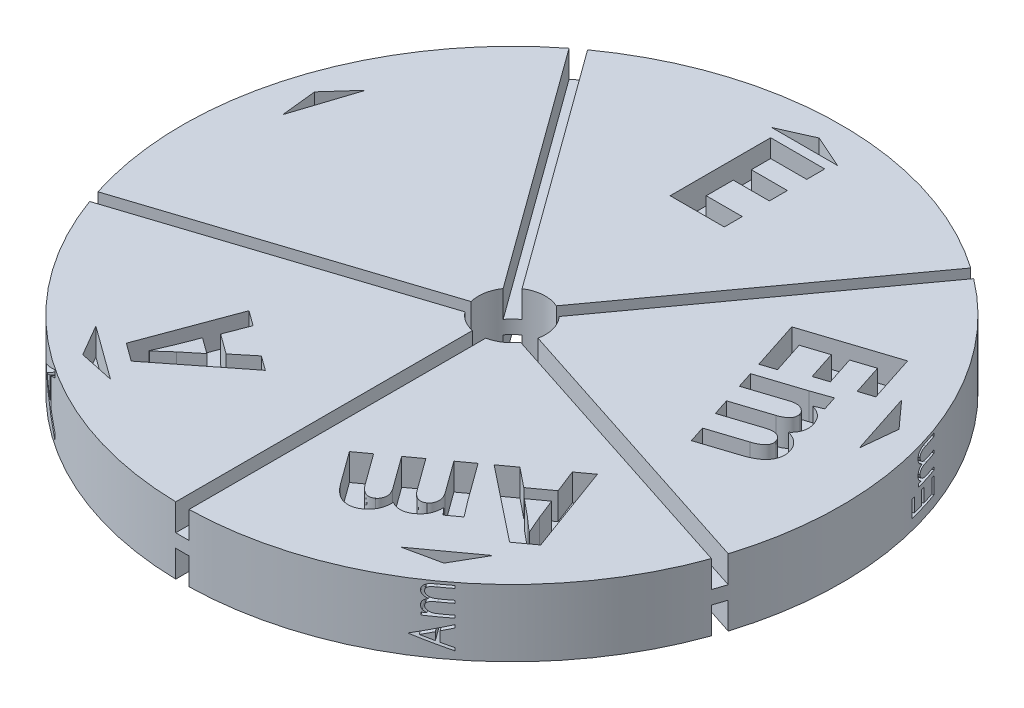
from build123d import *

# Parameters (mm, degrees)
SKETCH2_R           = 31.242
SKETCH2_R_2         = 3.175
BOSS_EXTRUDE1_DEPTH = 6.35
CUT_EXTRUDE2_START  = -2.54
CUT_EXTRUDE2_DEPTH  = 2.54
CUT_EXTRUDE3_DEPTH  = 2.54
CUT_EXTRUDE5_DEPTH  = 2.54
CUT_EXTRUDE6_DEPTH  = 2.54
CUT_EXTRUDE7_DEPTH  = 2.54
CUT_EXTRUDE8_DEPTH  = 2.54


with BuildPart() as part:
    # Sketch2 → Boss-Extrude1 (new body)
    with BuildSketch(Plane(origin=(0, 0, 0), x_dir=(1, 0, 0), z_dir=(0, 1, 0))):
        Circle(SKETCH2_R)
        Circle(SKETCH2_R_2, mode=Mode.SUBTRACT)
    extrude(amount=BOSS_EXTRUDE1_DEPTH)

    # Sketch4 → Cut-Extrude2 (cut)
    with BuildSketch(Plane(origin=(0, 6.35, 0), x_dir=(1, 0, 0), z_dir=(0, 1, 0)).offset(CUT_EXTRUDE2_START)):
        with BuildLine():
            ThreePointArc((1.321164717, 2.887065775), (1.866218176, 2.568628957), (2.337500369, 2.148654702))
            Line((2.337500369, 2.148654702), (18.922396946, 24.975806503))
            Line((18.922396946, 24.975806503), (17.906061294, 25.714217577))
            Line((17.906061294, 25.714217577), (1.321164717, 2.887065775))
        make_face()
        with BuildLine():
            ThreePointArc((-2.621171805, 1.791670552), (-2.210254039, 2.279342468), (-1.710169165, 2.675060079))
            Line((-1.710169165, 2.675060079), (-18.345386326, 25.571472221))
            Line((-18.345386326, 25.571472221), (-19.361721977, 24.833061148))
            Line((-19.361721977, 24.833061148), (-2.621171805, 1.791670552))
        make_face()
        with BuildLine():
            ThreePointArc((-2.513966587, -1.939225877), (-2.850789567, -1.397720948), (-3.072604655, -0.799828503))
            Line((-3.072604655, -0.799828503), (-30.428276462, -9.688225077))
            Line((-30.428276462, -9.688225077), (-30.040070787, -10.882999292))
            Line((-30.040070787, -10.882999292), (-2.513966587, -1.939225877))
        make_face()
        with BuildLine():
            Line((30.260469232, -9.45725824), (3.11069628, -0.63576226))
            ThreePointArc((3.11069628, -0.63576226), (2.922478818, -1.240863634), (2.617840994, -1.796533754))
            Line((2.617840994, -1.796533754), (29.872263557, -10.652032455))
            Line((29.872263557, -10.652032455), (30.260469232, -9.45725824))
        make_face()
        with BuildLine():
            ThreePointArc((0.628129977, -3.112246413), (0, -3.175), (-0.628129977, -3.112246413))
            Line((-0.628129977, -3.112246413), (-0.628129977, -32.075582159))
            Line((-0.628129977, -32.075582159), (0.628129977, -32.075582159))
            Line((0.628129977, -32.075582159), (0.628129977, -3.112246413))
        make_face()
    cut_extrude2 = extrude(amount=CUT_EXTRUDE2_DEPTH, mode=Mode.SUBTRACT)

    # Sketch3 → Cut-Extrude3 (cut)
    # profile 1 of 11: a face of its own
    with BuildSketch(Plane(origin=(0, 6.35, 0), x_dir=(1, 0, 0), z_dir=(0, 1, 0))):
        Polygon((-2.320192308, 26.846368203), (2.808653846, 26.846368203), (2.808653846, 25.136752819), (-0.610576923, 25.136752819), (-0.610576923, 23.305022049), (2.808653846, 23.305022049), (2.808653846, 21.595406665), (-0.610576923, 21.595406665), (-0.610576923, 19.030983588), (2.808653846, 19.030983588), (2.808653846, 17.321368203), (-2.320192308, 17.321368203), align=None)
    # profile 2 of 11: a face of its own
    with BuildSketch(Plane(origin=(0, 6.35, 0), x_dir=(1, 0, 0), z_dir=(0, 1, 0))):
        Polygon((16.061624465, 11.165408665), (18.366605143, 11.914441762), (19.245143963, 9.210936387), (20.54842743, 9.634455101), (19.669888611, 12.337960476), (21.673283032, 12.988989243), (22.604324172, 10.123919802), (23.939920452, 10.557938979), (22.490856423, 15.017107207), (14.208005295, 12.325488274), (15.713071798, 7.693985042), (17.048668079, 8.12800422), align=None)
    # profile 3 of 11: a face of its own
    with BuildSketch(Plane(origin=(0, 6.35, 0), x_dir=(1, 0, 0), z_dir=(0, 1, 0))):
        with BuildLine():
            Line((21.744517704, 6.790660341), (21.735401618, 6.823869398))
            Line((21.735401618, 6.823869398), (22.507949929, 7.158277407))
            Line((22.507949929, 7.158277407), (22.066930442, 8.515415564))
            add(Edge.make_bspline(
                [(22.066930442, 8.515415564), (21.793069657, 8.411137486), (21.200599862, 8.193395745), (20.601267789, 7.99535925), (20.281027341, 7.887048978)],
                knots=[0, 0, 0, 0, 0.464326186, 1, 1, 1, 1], degree=3))
            Line((20.281027341, 7.887048978), (16.092289672, 6.526245822))
            Line((16.092289672, 6.526245822), (16.599812097, 4.964459849))
            Line((16.599812097, 4.964459849), (20.208076243, 6.137011659))
            add(Edge.make_bspline(
                [(20.208076243, 6.137011659), (20.303581676, 6.167428472), (20.446570306, 6.196113322), (20.634500795, 6.22100026), (20.765170007, 6.223863486), (20.889144326, 6.215899216), (21.006531265, 6.196966389), (21.116547379, 6.163322885), (21.252137127, 6.107545693), (21.401517165, 6.019186987), (21.598578277, 5.851829373), (21.699344804, 5.68969266), (21.736323469, 5.572997026)],
                knots=[0, 0, 0, 0, 0.166013403, 0.241834974, 0.314413964, 0.382586504, 0.44789349, 0.511308969, 0.573121726, 0.691025745, 0.797761554, 1, 1, 1, 1], degree=3))
            add(Edge.make_bspline(
                [(21.736323469, 5.572997026), (21.758803363, 5.500116599), (21.779085078, 5.389968116), (21.779681943, 5.244792996), (21.76648356, 5.14394998), (21.740640234, 5.047427839), (21.698127107, 4.956557008), (21.644661838, 4.869305517), (21.551632948, 4.760816616), (21.411511521, 4.636634343), (21.136369171, 4.455888364), (20.898475305, 4.358993731), (20.730071416, 4.306168301)],
                knots=[0, 0, 0, 0, 0.125368565, 0.182880941, 0.238166827, 0.292234244, 0.346525235, 0.402630324, 0.460044328, 0.580942748, 0.709299201, 1, 1, 1, 1], degree=3))
            Line((20.730071416, 4.306168301), (17.18783808, 3.154942307))
            Line((17.18783808, 3.154942307), (17.695360506, 1.593156333))
            Line((17.695360506, 1.593156333), (21.335937465, 2.776208608))
            add(Edge.make_bspline(
                [(21.335937465, 2.776208608), (21.433843159, 2.805573117), (21.578847176, 2.839038007), (21.769204236, 2.862240211), (21.899160599, 2.867630887), (22.02150783, 2.861064201), (22.136242495, 2.84422498), (22.242790612, 2.812165454), (22.370606572, 2.756455053), (22.511085979, 2.668091982), (22.697166494, 2.500357399), (22.790617334, 2.338631039), (22.824517872, 2.223193774)],
                knots=[0, 0, 0, 0, 0.172621452, 0.25066996, 0.323610578, 0.391985162, 0.457362096, 0.518957846, 0.579289924, 0.692443371, 0.79757912, 1, 1, 1, 1], degree=3))
            add(Edge.make_bspline(
                [(22.824517872, 2.223193774), (22.848869589, 2.149588583), (22.869110652, 2.037460612), (22.869162266, 1.889622069), (22.857428587, 1.785940569), (22.826534076, 1.687248616), (22.781388895, 1.59361474), (22.724652828, 1.502579225), (22.623263084, 1.388518728), (22.467877789, 1.254205041), (22.148422815, 1.056743703), (21.872799601, 0.94763215), (21.675686131, 0.885894629)],
                knots=[0, 0, 0, 0, 0.116847431, 0.170441447, 0.222803547, 0.273664007, 0.325667837, 0.379420182, 0.434957811, 0.555338216, 0.688012192, 1, 1, 1, 1], degree=3))
            Line((21.675686131, 0.885894629), (18.283386489, -0.216361209))
            Line((18.283386489, -0.216361209), (18.790908914, -1.778147182))
            Line((18.790908914, -1.778147182), (22.431485873, -0.595094907))
            add(Edge.make_bspline(
                [(22.431485873, -0.595094907), (22.632318385, -0.52806093), (22.918752923, -0.415556978), (23.271341853, -0.234498806), (23.500124322, -0.095316507), (23.702841551, 0.051644685), (23.87845508, 0.208274744), (24.027453002, 0.373648163), (24.146920326, 0.549251738), (24.244809427, 0.728069174), (24.317914621, 0.91128684), (24.374052033, 1.096201041), (24.404799236, 1.284630867), (24.412774627, 1.47601423), (24.394806413, 1.738103984), (24.348456848, 1.93318061), (24.306035552, 2.060947922)],
                knots=[0, 0, 0, 0, 0.172995803, 0.250842261, 0.323557111, 0.391577454, 0.455103819, 0.515479352, 0.572919993, 0.62823557, 0.681690649, 0.733800434, 0.785820317, 0.837192912, 0.8899768, 1, 1, 1, 1], degree=3))
            add(Edge.make_bspline(
                [(24.306035552, 2.060947922), (24.255653479, 2.227126112), (24.147665941, 2.465334901), (23.948755205, 2.750498397), (23.771774172, 2.947230717), (23.563527606, 3.127284492), (23.22178535, 3.339082314), (22.930880091, 3.451966672), (22.726187052, 3.512966357)],
                knots=[0, 0, 0, 0, 0.232075901, 0.347037781, 0.46400119, 0.585291806, 0.71405303, 1, 1, 1, 1], degree=3))
            Line((22.726187052, 3.512966357), (22.720551915, 3.535774178))
            add(Edge.make_bspline(
                [(22.720551915, 3.535774178), (22.85051314, 3.641703388), (23.022248944, 3.826608986), (23.183262782, 4.118027769), (23.268366711, 4.351251706), (23.318353266, 4.598246212), (23.330203745, 4.950266251), (23.281416624, 5.2159256), (23.224396538, 5.389446163)],
                knots=[0, 0, 0, 0, 0.245810699, 0.364787803, 0.48585838, 0.608329151, 0.732517645, 1, 1, 1, 1], degree=3))
            add(Edge.make_bspline(
                [(23.224396538, 5.389446163), (23.188158971, 5.495167723), (23.125689087, 5.647492881), (23.02556091, 5.837178401), (22.946321402, 5.965533854), (22.863404366, 6.084368369), (22.772362859, 6.191341255), (22.676247647, 6.288245081), (22.54104176, 6.400057803), (22.369489779, 6.519884352), (22.099694944, 6.675967802), (21.887149331, 6.756582145), (21.744517704, 6.790660341)],
                knots=[0, 0, 0, 0, 0.157381183, 0.231375592, 0.301837962, 0.369720387, 0.435228795, 0.499422885, 0.561679052, 0.682063178, 0.793712791, 1, 1, 1, 1], degree=3))
        make_face()
    # profile 4 of 11: a face of its own
    with BuildSketch(Plane(origin=(0, 6.35, 0), x_dir=(1, 0, 0), z_dir=(0, 1, 0))):
        Polygon((20.215288557, -17.487812686), (17.094083655, -8.990795944), (15.719708798, -9.989228264), (16.585308088, -12.201994992), (14.697833283, -13.573175378), (12.842684096, -12.079279921), (11.422496743, -13.110993319), (18.511063733, -18.725868763), align=None)
        with BuildLine():
            Line((18.613664517, -16.94384352), (18.587767854, -16.962390979))
            add(Edge.make_bspline(
                [(18.587767854, -16.962390979), (18.362196165, -16.762235832), (17.912652854, -16.353596591), (17.454957791, -15.954047493), (17.220644574, -15.757318298)],
                knots=[0, 0, 0, 0, 0.496404428, 1, 1, 1, 1], degree=3))
            Line((17.220644574, -15.757318298), (15.635741896, -14.459594747))
            Line((15.635741896, -14.459594747), (17.13839174, -13.36797541))
            Line((17.13839174, -13.36797541), (17.888410706, -15.286761155))
            add(Edge.make_bspline(
                [(17.888410706, -15.286761155), (18.001055747, -15.562446104), (18.239913244, -16.116161951), (18.491142566, -16.664330533), (18.613664517, -16.94384352)],
                knots=[0, 0, 0, 0, 0.493880145, 1, 1, 1, 1], degree=3))
        make_face(mode=Mode.SUBTRACT)
    # profile 5 of 11: a face of its own
    with BuildSketch(Plane(origin=(0, 6.35, 0), x_dir=(1, 0, 0), z_dir=(0, 1, 0))):
        with BuildLine():
            Line((12.543456694, -19.045688456), (12.571077027, -19.024111371))
            Line((12.571077027, -19.024111371), (13.127774465, -19.655542792))
            Line((13.127774465, -19.655542792), (14.282249346, -18.816859644))
            add(Edge.make_bspline(
                [(14.282249346, -18.816859644), (14.095101032, -18.591505554), (13.715355377, -18.087800359), (13.330670959, -17.587930342), (13.133441611, -17.313427186)],
                knots=[0, 0, 0, 0, 0.464235478, 1, 1, 1, 1], degree=3))
            Line((13.133441611, -17.313427186), (10.54474355, -13.749135033))
            Line((10.54474355, -13.749135033), (9.216181187, -14.714286276))
            Line((9.216181187, -14.714286276), (11.446013369, -17.783723458))
            add(Edge.make_bspline(
                [(11.446013369, -17.783723458), (11.502990117, -17.866174291), (11.575865397, -17.992843313), (11.656123921, -18.164498472), (11.701114941, -18.287117817), (11.730083659, -18.40825437), (11.749638909, -18.526015233), (11.752006728, -18.641595114), (11.741651813, -18.787420652), (11.703313792, -18.956552611), (11.605383222, -19.195813556), (11.480776159, -19.341273338), (11.381514177, -19.412790182)],
                knots=[0, 0, 0, 0, 0.166107114, 0.241931524, 0.314167343, 0.382302066, 0.448306284, 0.511766893, 0.573555552, 0.690523399, 0.79773616, 1, 1, 1, 1], degree=3))
            add(Edge.make_bspline(
                [(11.381514177, -19.412790182), (11.318390661, -19.454575993), (11.221304832, -19.510257592), (11.083873167, -19.555465677), (10.983533468, -19.574437632), (10.883637799, -19.577011298), (10.784217733, -19.567798636), (10.685569587, -19.542151032), (10.553733747, -19.488163692), (10.391143794, -19.393660285), (10.13461856, -19.186814618), (9.967851815, -18.991439121), (9.865580709, -18.84738797)],
                knots=[0, 0, 0, 0, 0.124851952, 0.182559899, 0.237395695, 0.292260957, 0.346466819, 0.401191977, 0.459283741, 0.580485066, 0.709084836, 1, 1, 1, 1], degree=3))
            Line((9.865580709, -18.84738797), (7.676881347, -15.832530475))
            Line((7.676881347, -15.832530475), (6.348318984, -16.797681717))
            Line((6.348318984, -16.797681717), (8.598119812, -19.894606397))
            add(Edge.make_bspline(
                [(8.598119812, -19.894606397), (8.654618998, -19.979942281), (8.735092559, -20.105972812), (8.813165927, -20.281525813), (8.861156878, -20.403185354), (8.891944353, -20.522100706), (8.908830356, -20.636978176), (8.912465348, -20.747565612), (8.899300705, -20.88660287), (8.857493992, -21.047206343), (8.757291316, -21.276924183), (8.630429488, -21.414723954), (8.531559258, -21.482653933)],
                knots=[0, 0, 0, 0, 0.173022909, 0.25097622, 0.323896322, 0.393417358, 0.457674722, 0.519451934, 0.579613048, 0.692719402, 0.797903228, 1, 1, 1, 1], degree=3))
            add(Edge.make_bspline(
                [(8.531559258, -21.482653933), (8.468701815, -21.527892933), (8.369006146, -21.583043132), (8.228485079, -21.628971888), (8.125371428, -21.647257227), (8.021997391, -21.65120466), (7.918361258, -21.636883097), (7.815122738, -21.609355533), (7.67518215, -21.54904976), (7.499876421, -21.441926169), (7.212997408, -21.199591675), (7.025516781, -20.969456642), (6.904184195, -20.802532431)],
                knots=[0, 0, 0, 0, 0.116790975, 0.170487713, 0.22238944, 0.274343501, 0.325870813, 0.379656045, 0.435071312, 0.555225712, 0.688094073, 1, 1, 1, 1], degree=3))
            Line((6.904184195, -20.802532431), (4.809019144, -17.915925916))
            Line((4.809019144, -17.915925916), (3.480456781, -18.881077159))
            Line((3.480456781, -18.881077159), (5.73025761, -21.978001838))
            add(Edge.make_bspline(
                [(5.73025761, -21.978001838), (5.856645407, -22.148027097), (6.05053957, -22.387502482), (6.331867421, -22.667379854), (6.535255091, -22.842133789), (6.738090668, -22.989083753), (6.941937895, -23.106879151), (7.144603624, -23.198425131), (7.348350494, -23.25916548), (7.549124076, -23.294812433), (7.746370909, -23.310882935), (7.939192561, -23.301490394), (8.128185221, -23.274814847), (8.312202099, -23.222167006), (8.557931178, -23.127872296), (8.728182747, -23.021034803), (8.836384799, -22.941227756)],
                knots=[0, 0, 0, 0, 0.173047411, 0.250945515, 0.323703412, 0.391778996, 0.455121368, 0.515622304, 0.572909428, 0.628199869, 0.681870989, 0.7341014, 0.785508388, 0.837339278, 0.890015294, 1, 1, 1, 1], degree=3))
            add(Edge.make_bspline(
                [(8.836384799, -22.941227756), (8.976121923, -22.839956914), (9.172249294, -22.66715392), (9.380787987, -22.3890015), (9.512819353, -22.159274679), (9.620082396, -21.905998974), (9.718180291, -21.516304021), (9.735570938, -21.204654437), (9.729556409, -20.990999835)],
                knots=[0, 0, 0, 0, 0.23128825, 0.346683186, 0.463962733, 0.585241334, 0.713653856, 1, 1, 1, 1], degree=3))
            Line((9.729556409, -20.990999835), (9.748246307, -20.976807164))
            add(Edge.make_bspline(
                [(9.748246307, -20.976807164), (9.888613774, -21.068648947), (10.117440984, -21.176545904), (10.444789384, -21.237921686), (10.692809756, -21.248299528), (10.9437323, -21.218930454), (11.282163409, -21.119531232), (11.520434689, -20.991765469), (11.6683124, -20.884474781)],
                knots=[0, 0, 0, 0, 0.245830052, 0.364726023, 0.485588232, 0.608004352, 0.732803485, 1, 1, 1, 1], degree=3))
            add(Edge.make_bspline(
                [(11.6683124, -20.884474781), (11.83774195, -20.75451788), (12.065590501, -20.542106111), (12.294260473, -20.213596863), (12.404677549, -19.965977679), (12.477981019, -19.721994324), (12.544417635, -19.417989348), (12.553469423, -19.190996575), (12.543456694, -19.045688456)],
                knots=[0, 0, 0, 0, 0.301371534, 0.435589983, 0.561794324, 0.681954187, 0.79454247, 1, 1, 1, 1], degree=3))
        make_face()
    # profile 6 of 11: a face of its own
    with BuildSketch(Plane(origin=(0, 6.35, 0), x_dir=(1, 0, 0), z_dir=(0, 1, 0))):
        Polygon((-14.28777771, -21.794747306), (-7.171723222, -16.199840508), (-8.54609808, -15.201408188), (-10.38292227, -16.708616075), (-12.270397074, -15.337435689), (-11.423122782, -13.111356531), (-12.843310135, -12.079643133), (-15.992002533, -20.556691229), align=None)
        with BuildLine():
            Line((-14.264283302, -20.105489765), (-14.291181838, -20.084519245))
            add(Edge.make_bspline(
                [(-14.291181838, -20.084519245), (-14.169969912, -19.808715112), (-13.919950936, -19.255810723), (-13.683493469, -18.696942243), (-13.56777333, -18.414199669)],
                knots=[0, 0, 0, 0, 0.496504464, 1, 1, 1, 1], degree=3))
            Line((-13.56777333, -18.414199669), (-12.823480726, -16.503416107))
            Line((-12.823480726, -16.503416107), (-11.320830882, -17.595035444))
            Line((-11.320830882, -17.595035444), (-12.913799761, -18.901449365))
            add(Edge.make_bspline(
                [(-12.913799761, -18.901449365), (-13.140410242, -19.094949127), (-13.59266849, -19.49401682), (-14.0388312, -19.899854931), (-14.264283302, -20.105489765)],
                knots=[0, 0, 0, 0, 0.494052073, 1, 1, 1, 1], degree=3))
        make_face(mode=Mode.SUBTRACT)
    # profile 7 of 11: a face of its own
    with BuildSketch(Plane(origin=(0, 6.35, 0), x_dir=(1, 0, 0), z_dir=(0, 1, 0))):
        Polygon((0, 29.121822197), (-3.104495287, 27.736076068), (3.13558484, 27.736076068), align=None)
    # profile 8 of 11: a face of its own
    with BuildSketch(Plane(origin=(0, 6.35, 0), x_dir=(1, 0, 0), z_dir=(0, 1, 0))):
        Polygon((27.347524884, 5.588800468), (27.696498767, 8.999137966), (25.419234079, 11.523469335), align=None)
    # profile 9 of 11: a face of its own
    with BuildSketch(Plane(origin=(0, 6.35, 0), x_dir=(1, 0, 0), z_dir=(0, 1, 0))):
        Polygon((13.766115046, -24.282007423), (17.117377607, -23.560049064), (18.814445916, -20.614180351), align=None)
    # profile 10 of 11: a face of its own
    with BuildSketch(Plane(origin=(0, 6.35, 0), x_dir=(1, 0, 0), z_dir=(0, 1, 0))):
        Polygon((-18.839597892, -20.59590637), (-17.117377607, -23.560049064), (-13.791267023, -24.263733442), align=None)
    # profile 11 of 11: a face of its own
    with BuildSketch(Plane(origin=(0, 6.35, 0), x_dir=(1, 0, 0), z_dir=(0, 1, 0))):
        Polygon((-25.409626878, 11.553037257), (-27.696498767, 8.999137966), (-27.337917684, 5.61836839), align=None)
    extrude(amount=-CUT_EXTRUDE3_DEPTH, mode=Mode.SUBTRACT)

    # Sketch6 → Cut-Extrude5 (cut)
    with BuildSketch(Plane(origin=(29.712907682, 6.35, -9.654308938), x_dir=(-0.3090169943749509, 0, -0.9510565162951525), z_dir=(0.9510565162951525, 0, -0.30901699437495095))):
        with BuildLine():
            Line((-1.265935326, -3.325207933), (-1.265935326, -3.040272036))
            Line((-1.265935326, -3.040272036), (-0.86270015, -3.040272036))
            add(Edge.make_bspline(
                [(-0.86270015, -3.040272036), (-0.897875684, -3.017956676), (-0.964834333, -2.975478107), (-1.05411956, -2.905811416), (-1.129687066, -2.836246052), (-1.169839746, -2.785328475), (-1.188977193, -2.761060297)],
                knots=[0, 0, 0, 0, 1.156398484, 2.201270891, 3.14269527, 4, 4, 4, 4], degree=3))
            add(Edge.make_bspline(
                [(-1.188977193, -2.761060297), (-1.207078671, -2.728212295), (-1.242714502, -2.663545427), (-1.279648269, -2.559817422), (-1.301920857, -2.453547339), (-1.305067319, -2.381674843), (-1.306640454, -2.345740786)],
                knots=[0, 0, 0, 0, 1.029112214, 2.025982067, 3.013051199, 4, 4, 4, 4], degree=3))
            add(Edge.make_bspline(
                [(-1.306640454, -2.345740786), (-1.305689013, -2.32152618), (-1.303799462, -2.273436253), (-1.291495166, -2.202017857), (-1.270420031, -2.132658791), (-1.241086817, -2.065989222), (-1.204929825, -2.003530897), (-1.163710277, -1.945711234), (-1.116295634, -1.89464049), (-1.062621221, -1.848838411), (-1.000115551, -1.80715885), (-0.925911028, -1.770653993), (-0.84065773, -1.735081551), (-0.778928428, -1.715577516), (-0.746308924, -1.705271034)],
                knots=[0, 0, 0, 0, 0.946455476, 1.879649655, 2.823380467, 3.773312109, 4.71994895, 5.639914597, 6.5429676, 7.43638817, 8.392480427, 9.470921426, 10.663563517, 12, 12, 12, 12], degree=3))
            add(Edge.make_bspline(
                [(-0.746308924, -1.705271034), (-0.789897153, -1.683121294), (-0.874045586, -1.640360532), (-0.987559307, -1.562515229), (-1.085498466, -1.47748146), (-1.165291422, -1.383400224), (-1.228573287, -1.283766727), (-1.273352991, -1.179187946), (-1.301626442, -1.070734649), (-1.304964663, -0.996915624), (-1.306640454, -0.959858374)],
                knots=[0, 0, 0, 0, 1.189404311, 2.296182004, 3.342184252, 4.338261437, 5.289258256, 6.204982299, 7.098898681, 8, 8, 8, 8], degree=3))
            add(Edge.make_bspline(
                [(-1.306640454, -0.959858374), (-1.3051764, -0.925814118), (-1.302297985, -0.858881173), (-1.279432609, -0.761640044), (-1.241527774, -0.670642915), (-1.18817883, -0.587145111), (-1.121774402, -0.51171346), (-1.042447291, -0.446280843), (-0.951327997, -0.391394051), (-0.866268845, -0.355161258), (-0.791019056, -0.330801322), (-0.726574161, -0.315154053), (-0.655432717, -0.301912167), (-0.5776989, -0.291486983), (-0.493557561, -0.282143116), (-0.402479628, -0.277100099), (-0.304739131, -0.272922599), (-0.237288294, -0.272527178), (-0.202513851, -0.272323318)],
                knots=[0, 0, 0, 0, 1.111047388, 2.184382424, 3.24278181, 4.316652798, 5.405819654, 6.512304555, 7.661871258, 8.868441487, 9.523209744, 10.243700779, 11.032770805, 11.885734012, 12.804907568, 13.797084314, 14.864281476, 16, 16, 16, 16], degree=3))
            Line((-0.202513851, -0.272323318), (1.054256982, -0.272323318))
            Line((1.054256982, -0.272323318), (1.054256982, -0.557259215))
            Line((1.054256982, -0.557259215), (-0.203785887, -0.557259215))
            add(Edge.make_bspline(
                [(-0.203785887, -0.557259215), (-0.233466962, -0.557391262), (-0.290503724, -0.557645012), (-0.372373333, -0.559280785), (-0.447007636, -0.56323477), (-0.514459736, -0.568178115), (-0.574708758, -0.574454775), (-0.627851572, -0.581785543), (-0.673527139, -0.591181966), (-0.724207605, -0.605403659), (-0.779786765, -0.627950963), (-0.840198592, -0.662261152), (-0.892513704, -0.706470094), (-0.938728867, -0.757055546), (-0.975627103, -0.815192512), (-1.002834105, -0.879096513), (-1.019098679, -0.948663293), (-1.020822222, -0.996872367), (-1.021704557, -1.021552084)],
                knots=[0, 0, 0, 0, 1.330018142, 2.555834944, 3.668782313, 4.67863418, 5.586109635, 6.382798523, 7.081476318, 7.673906836, 8.739419882, 9.761044311, 10.773038723, 11.795502015, 12.820653859, 13.842278288, 14.895395529, 16, 16, 16, 16], degree=3))
            add(Edge.make_bspline(
                [(-1.021704557, -1.021552084), (-1.020010596, -1.051797883), (-1.016630816, -1.112144098), (-0.992410072, -1.200593914), (-0.951184774, -1.284234386), (-0.895708398, -1.362859467), (-0.827379293, -1.434596754), (-0.746498964, -1.496057968), (-0.655696214, -1.54774392), (-0.571394601, -1.581945293), (-0.495786421, -1.603547719), (-0.429535618, -1.61806998), (-0.35413988, -1.630009977), (-0.27004968, -1.639098965), (-0.177162414, -1.646756421), (-0.075584595, -1.652495293), (0.035127153, -1.655448363), (0.111889344, -1.656007398), (0.151747967, -1.656297677)],
                knots=[0, 0, 0, 0, 0.970977457, 1.937287705, 2.920979925, 3.952440061, 5.016820328, 6.090050699, 7.203235515, 8.364032368, 9.001938422, 9.727226715, 10.541084532, 11.452475461, 12.443212931, 13.53443812, 14.719761628, 16, 16, 16, 16], degree=3))
            Line((0.151747967, -1.656297677), (1.054256982, -1.656297677))
            Line((1.054256982, -1.656297677), (1.054256982, -1.941233574))
            Line((1.054256982, -1.941233574), (-0.125555718, -1.941233574))
            add(Edge.make_bspline(
                [(-0.125555718, -1.941233574), (-0.158840907, -1.941366055), (-0.222873149, -1.941620915), (-0.314702695, -1.943252689), (-0.398243424, -1.947186165), (-0.473318149, -1.952162579), (-0.53994931, -1.958302638), (-0.598270209, -1.966030222), (-0.648357217, -1.974265291), (-0.703156065, -1.988743089), (-0.762955779, -2.01112924), (-0.827799573, -2.04538647), (-0.884277453, -2.089526291), (-0.93348112, -2.140794727), (-0.972962057, -2.199265245), (-1.001773712, -2.263712878), (-1.018369407, -2.333672197), (-1.020579004, -2.382119691), (-1.021704557, -2.406798478)],
                knots=[0, 0, 0, 0, 1.395550625, 2.684684642, 3.850322058, 4.90159369, 5.839127943, 6.655000055, 7.368146774, 7.965344177, 9.028572653, 10.038758203, 11.027281416, 12.020668143, 13.006790664, 13.969767158, 14.965814729, 16, 16, 16, 16], degree=3))
            add(Edge.make_bspline(
                [(-1.021704557, -2.406798478), (-1.020316583, -2.436011051), (-1.017545046, -2.494343376), (-0.99237288, -2.579751749), (-0.952938558, -2.662058141), (-0.89899647, -2.740497138), (-0.831502556, -2.812114275), (-0.752667361, -2.874850613), (-0.663128762, -2.927291815), (-0.580345091, -2.962441378), (-0.506581729, -2.984775826), (-0.443551803, -3.000031628), (-0.373453293, -3.012602917), (-0.296571474, -3.022406124), (-0.212823111, -3.030880951), (-0.122227286, -3.036373886), (-0.024450562, -3.039443), (0.04298666, -3.039988866), (0.077969923, -3.040272036)],
                knots=[0, 0, 0, 0, 0.986498303, 1.969862037, 2.986972612, 4.06537281, 5.176764093, 6.304882096, 7.462534857, 8.67759155, 9.337881572, 10.06860333, 10.870597364, 11.746116293, 12.690428084, 13.718232799, 14.816326358, 16, 16, 16, 16], degree=3))
            Line((0.077969923, -3.040272036), (1.054256982, -3.040272036))
            Line((1.054256982, -3.040272036), (1.054256982, -3.325207933))
            Line((1.054256982, -3.325207933), (-1.265935326, -3.325207933))
        make_face()
        Polygon((-2.120743018, -5.360464343), (-2.120743018, -3.772964343), (-1.795101993, -3.772964343), (-1.795101993, -5.075528446), (-0.818178916, -5.075528446), (-0.818178916, -3.772964343), (-0.49253789, -3.772964343), (-0.49253789, -5.075528446), (0.728615956, -5.075528446), (0.728615956, -3.772964343), (1.054256982, -3.772964343), (1.054256982, -5.360464343), align=None)
    extrude(amount=-CUT_EXTRUDE5_DEPTH, mode=Mode.SUBTRACT)

    # Sketch7 → Cut-Extrude6 (cut)
    # profile 1 of 2: a face of its own
    with BuildSketch(Plane(origin=(18.363586852, 6.35, 25.275308938), x_dir=(0.8090169943749508, 0, -0.5877852522924687), z_dir=(0.5877852522924687, 0, 0.8090169943749508))):
        with BuildLine():
            Line((-1.223357827, -2.932275185), (-1.223357827, -2.688044416))
            Line((-1.223357827, -2.688044416), (-0.82012265, -2.688044416))
            add(Edge.make_bspline(
                [(-0.82012265, -2.688044416), (-0.855276832, -2.668521251), (-0.922022436, -2.631453531), (-1.010898571, -2.569327014), (-1.086636249, -2.508278247), (-1.127203129, -2.462793374), (-1.146399694, -2.441269576)],
                knots=[0, 0, 0, 0, 1.171933473, 2.225095347, 3.16010125, 4, 4, 4, 4], degree=3))
            add(Edge.make_bspline(
                [(-1.146399694, -2.441269576), (-1.16445488, -2.412270828), (-1.199724612, -2.3556235), (-1.236892893, -2.264007063), (-1.259341698, -2.170138594), (-1.26249069, -2.106631819), (-1.264062955, -2.074923423)],
                knots=[0, 0, 0, 0, 1.048657587, 2.048490186, 3.025627617, 4, 4, 4, 4], degree=3))
            add(Edge.make_bspline(
                [(-1.264062955, -2.074923423), (-1.263089194, -2.053464182), (-1.261145862, -2.010638018), (-1.249103438, -1.94733023), (-1.227483265, -1.886154556), (-1.198262221, -1.827322129), (-1.162343916, -1.771885587), (-1.120600602, -1.721023263), (-1.073429179, -1.675733059), (-1.019591141, -1.63529901), (-0.957246195, -1.598079742), (-0.882981318, -1.56626981), (-0.797998375, -1.534227542), (-0.736346189, -1.517641797), (-0.703731424, -1.508867733)],
                knots=[0, 0, 0, 0, 0.894244548, 1.784642113, 2.672934302, 3.589368707, 4.515457188, 5.419074897, 6.32489156, 7.232901851, 8.219046244, 9.34187893, 10.593821297, 12, 12, 12, 12], degree=3))
            add(Edge.make_bspline(
                [(-0.703731424, -1.508867733), (-0.747237412, -1.489439254), (-0.830814966, -1.452116006), (-0.944168428, -1.383349432), (-1.041970835, -1.308699244), (-1.122327383, -1.226152369), (-1.185272336, -1.138170393), (-1.230780706, -1.045942552), (-1.258888188, -0.949959875), (-1.262342389, -0.884478381), (-1.264062955, -0.851861523)],
                knots=[0, 0, 0, 0, 1.247221846, 2.395986314, 3.464760322, 4.462445041, 5.402531744, 6.286834893, 7.146658713, 8, 8, 8, 8], degree=3))
            add(Edge.make_bspline(
                [(-1.264062955, -0.851861523), (-1.262590662, -0.821830565), (-1.259687502, -0.762613603), (-1.236701098, -0.676658836), (-1.198367372, -0.596396731), (-1.14514356, -0.522590803), (-1.078444466, -0.456186545), (-0.999152349, -0.398589186), (-0.908102709, -0.350335025), (-0.823507385, -0.318183708), (-0.748252354, -0.297433777), (-0.683883446, -0.283648982), (-0.612824806, -0.271523907), (-0.535098112, -0.262369992), (-0.450926816, -0.254506732), (-0.35990008, -0.249804911), (-0.262146964, -0.246531853), (-0.194708379, -0.246007226), (-0.159936352, -0.245736724)],
                knots=[0, 0, 0, 0, 1.020840665, 2.012958808, 3.003580879, 4.032545746, 5.093557112, 6.193036156, 7.354903874, 8.590171582, 9.264007904, 10.009699009, 10.829202303, 11.715928542, 12.672093582, 13.705298083, 14.81682812, 16, 16, 16, 16], degree=3))
            Line((-0.159936352, -0.245736724), (1.096834481, -0.245736724))
            Line((1.096834481, -0.245736724), (1.096834481, -0.489967493))
            Line((1.096834481, -0.489967493), (-0.161208387, -0.489967493))
            add(Edge.make_bspline(
                [(-0.161208387, -0.489967493), (-0.190890306, -0.490079959), (-0.24792869, -0.490296079), (-0.329777257, -0.492188998), (-0.404423276, -0.495292078), (-0.471866358, -0.499676252), (-0.532126915, -0.505227613), (-0.585173657, -0.512184581), (-0.630896853, -0.520116813), (-0.681393565, -0.532761111), (-0.737081373, -0.5522039), (-0.796835034, -0.583587914), (-0.849620124, -0.62231732), (-0.895761018, -0.667197535), (-0.93277223, -0.718900467), (-0.959986071, -0.775610504), (-0.976575958, -0.837363798), (-0.978262532, -0.880166555), (-0.979127057, -0.902106916)],
                knots=[0, 0, 0, 0, 1.379815892, 2.651528998, 3.805683901, 4.85265046, 5.793122419, 6.618287872, 7.339363223, 7.94889696, 9.036811534, 10.072819673, 11.074216074, 12.070799561, 13.052654403, 14.013661544, 14.98181831, 16, 16, 16, 16], degree=3))
            add(Edge.make_bspline(
                [(-0.979127057, -0.902106916), (-0.97743852, -0.929193019), (-0.974063779, -0.983327805), (-0.949531896, -1.062535574), (-0.90829912, -1.137066057), (-0.852633738, -1.206908019), (-0.78388141, -1.270170156), (-0.703651786, -1.325369553), (-0.612336348, -1.370126576), (-0.52856982, -1.40071193), (-0.453126825, -1.419783599), (-0.386839031, -1.432263715), (-0.311496129, -1.442977881), (-0.227466055, -1.451620336), (-0.134572992, -1.458568153), (-0.032998029, -1.463740611), (0.077713849, -1.465856949), (0.154468113, -1.466537283), (0.194325467, -1.46689057)],
                knots=[0, 0, 0, 0, 0.898854865, 1.796467969, 2.725881113, 3.713327572, 4.749642467, 5.817921019, 6.935725297, 8.118350285, 8.772387787, 9.518048767, 10.357441673, 11.299042625, 12.322893087, 13.450829429, 14.676253454, 16, 16, 16, 16], degree=3))
            Line((0.194325467, -1.46689057), (1.096834481, -1.46689057))
            Line((1.096834481, -1.46689057), (1.096834481, -1.711121339))
            Line((1.096834481, -1.711121339), (-0.082978219, -1.711121339))
            add(Edge.make_bspline(
                [(-0.082978219, -1.711121339), (-0.116264017, -1.711235289), (-0.18029743, -1.7114545), (-0.272110069, -1.713330035), (-0.355654801, -1.716461319), (-0.430741223, -1.720727894), (-0.49729535, -1.726613951), (-0.55573557, -1.732521281), (-0.605648138, -1.740608455), (-0.660386638, -1.753159237), (-0.72002858, -1.772825053), (-0.784813662, -1.80308138), (-0.841163754, -1.842660346), (-0.890264137, -1.888060727), (-0.930428511, -1.939714273), (-0.958738648, -1.997269769), (-0.975931889, -2.059738351), (-0.978044966, -2.103009812), (-0.979127057, -2.125168815)],
                knots=[0, 0, 0, 0, 1.442426718, 2.774862328, 3.979267745, 5.065268496, 6.033466384, 6.874538464, 7.61009204, 8.22295772, 9.306624322, 10.325704742, 11.30942661, 12.277929572, 13.215073593, 14.127205556, 15.040955472, 16, 16, 16, 16], degree=3))
            add(Edge.make_bspline(
                [(-0.979127057, -2.125168815), (-0.97774347, -2.151226496), (-0.974974915, -2.203367854), (-0.949459971, -2.279452622), (-0.910090469, -2.352732372), (-0.855660742, -2.422282145), (-0.788672183, -2.486336824), (-0.709189036, -2.541029658), (-0.620022394, -2.587746797), (-0.537497121, -2.618995492), (-0.463938583, -2.63887586), (-0.400842543, -2.652011829), (-0.330853698, -2.663602586), (-0.253932121, -2.671858296), (-0.170239119, -2.679953073), (-0.079637714, -2.684782326), (0.018136804, -2.687037344), (0.0855654, -2.687700415), (0.120547422, -2.688044416)],
                knots=[0, 0, 0, 0, 0.911264108, 1.823437329, 2.78454677, 3.817910997, 4.906278776, 6.0219239, 7.18900795, 8.428799915, 9.106839946, 9.859131277, 10.687692098, 11.593146783, 12.57101307, 13.635666511, 14.773381479, 16, 16, 16, 16], degree=3))
            Line((0.120547422, -2.688044416), (1.096834481, -2.688044416))
            Line((1.096834481, -2.688044416), (1.096834481, -2.932275185))
            Line((1.096834481, -2.932275185), (-1.223357827, -2.932275185))
        make_face()
    # profile 2 of 2: a face of its own
    with BuildSketch(Plane(origin=(18.363586852, 6.35, 25.275308938), x_dir=(0.8090169943749508, 0, -0.5877852522924687), z_dir=(0.5877852522924687, 0, 0.8090169943749508))):
        Polygon((-2.078165519, -4.519775185), (1.096834481, -3.461441852), (1.096834481, -3.727297221), (0.079206276, -4.065658599), (0.079206276, -5.012688847), (1.096834481, -5.352322261), (1.096834481, -5.618813647), (-2.078165519, -4.560480314), align=None)
        Polygon((-1.341021088, -4.539491732), (-0.24643475, -4.903929833), (-0.24643475, -4.174417613), align=None, mode=Mode.SUBTRACT)
    extrude(amount=-CUT_EXTRUDE6_DEPTH, mode=Mode.SUBTRACT)

    # Sketch8 → Cut-Extrude7 (cut)
    with BuildSketch(Plane(origin=(-18.363586852, 6.35, 25.275308938), x_dir=(0.8090169943749387, 0, 0.5877852522924852), z_dir=(-0.5877852522924852, 0, 0.8090169943749387))):
        Polygon((-3.50004736, -2.930769231), (1.26245264, -0.122115385), (1.26245264, -0.79375), (-0.263989667, -1.693396935), (-0.263989667, -4.326509916), (1.26245264, -5.247145433), (1.26245264, -5.922596154), (-3.50004736, -3.052884615), align=None)
        Polygon((-2.473514908, -2.995643029), (-0.752451206, -4.033623798), (-0.752451206, -1.980558894), align=None, mode=Mode.SUBTRACT)
    extrude(amount=-CUT_EXTRUDE7_DEPTH, mode=Mode.SUBTRACT)

    # Sketch9 → Cut-Extrude8 (cut)
    with BuildSketch(Plane(origin=(0, 6.35, -31.242), x_dir=(-1, 0, 0), z_dir=(0, 0, -1))):
        Polygon((-2.247055713, -4.74866696), (-2.247055713, -1.465119951), (-1.650047166, -1.465119951), (-1.650047166, -4.226284481), (0.140978475, -4.226284481), (0.140978475, -1.465119951), (0.737987022, -1.465119951), (0.737987022, -4.226284481), (2.976769074, -4.226284481), (2.976769074, -1.465119951), (3.573777621, -1.465119951), (3.573777621, -4.74866696), align=None)
    extrude(amount=-CUT_EXTRUDE8_DEPTH, mode=Mode.SUBTRACT)

    # Mirror4: Cut-Extrude2 across plane
    add(cut_extrude2.mirror(Plane.ZX.offset(3.175)), mode=Mode.SUBTRACT)


solid = part.part
